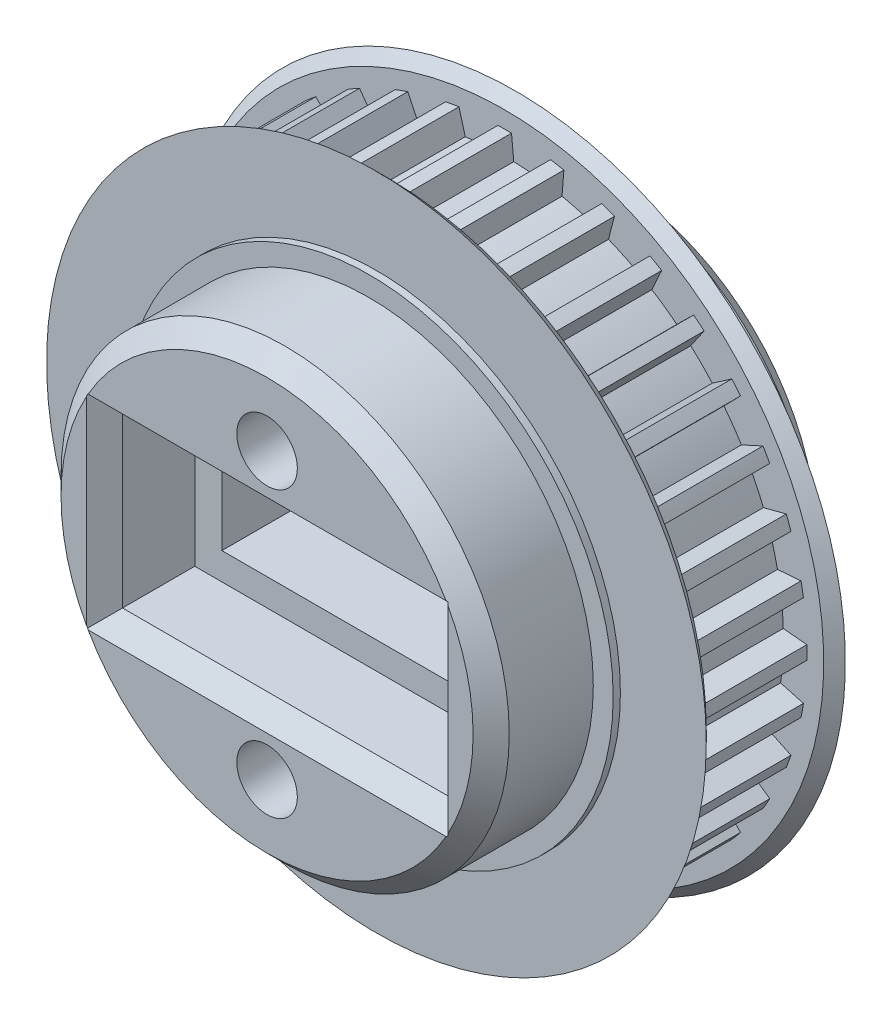
from build123d import *

# Parameters (mm, degrees)
CROQUIS1_R                 = 2
SALIENTE_EXTRUIR1_DEPTH    = 6.5
CROQUIS2_R                 = 18.25
CROQUIS2_R_2               = 2
SALIENTE_EXTRUIR2_DEPTH    = 0.6
SALIENTE_EXTRUIR4_START    = 5.8
CROQUIS4_R                 = 12.45
CROQUIS4_R_2               = 2
SALIENTE_EXTRUIR4_DEPTH    = 5.8
SALIENTE_EXTRUIR6_START    = 0.6
CROQUIS6_R                 = 18.25
CROQUIS6_R_2               = 2
SALIENTE_EXTRUIR6_DEPTH    = 0.6
SALIENTE_EXTRUIR5_START    = 0.4
CROQUIS5_R                 = 13.5
CROQUIS5_R_2               = 2
SALIENTE_EXTRUIR5_DEPTH    = 0.4
CROQUIS3_R                 = 12.4
CROQUIS3_R_2               = 2
SALIENTE_EXTRUIR7_DEPTH    = 6.05
CHAFL_N4_SIZE              = 1
CROQUIS7_R                 = 13.5
CROQUIS7_R_2               = 2
SALIENTE_EXTRUIR8_DEPTH    = 0.4
CORTAR_EXTRUIR1_DEPTH      = 29.966316645
CORTAR_EXTRUIR1_DEPTH_BACK = 29.966316645
CROQUIS8_R                 = 1.675
CROQUIS8_W                 = 15
CROQUIS8_H                 = 6.3
CORTAR_EXTRUIR2_DEPTH      = 7
REDONDEO1_R                = 2.5
CROQUIS10_W                = 18
CROQUIS10_H                = 9.3
CORTAR_EXTRUIR3_DEPTH      = 5
CHAFL_N5_SIZE              = 1
CHAFL_N6_SIZE              = 0.6


# Some blends are built 0.0001 mm under size
with BuildPart() as part:
    # Croquis1 → Saliente-Extruir1 (new body)
    with BuildSketch(Plane.XY):
        with BuildLine():
            Line((-0.375, 16.714216942), (-0.5, 15.410313844))
            ThreePointArc((-0.5, 15.410313844), (-1.343804123, 15.359751406), (-2.18356904, 15.263020639))
            Line((-2.18356904, 15.263020639), (-2.533090406, 16.525408497))
            ThreePointArc((-2.533090406, 16.525408497), (-2.903123715, 16.464432747), (-3.271696221, 16.395172363))
            Line((-3.271696221, 16.395172363), (-3.168376793, 15.089372461))
            ThreePointArc((-3.168376793, 15.089372461), (-3.99058156, 14.893053132), (-4.800791439, 14.651968275))
            Line((-4.800791439, 14.651968275), (-5.364214141, 15.834483876))
            ThreePointArc((-5.364214141, 15.834483876), (-5.718037486, 15.710178876), (-6.068983607, 15.577968769))
            Line((-6.068983607, 15.577968769), (-5.74048406, 14.309948132))
            ThreePointArc((-5.74048406, 14.309948132), (-6.516107195, 13.973836975), (-7.27214422, 13.595723269))
            Line((-7.27214422, 13.595723269), (-8.032348945, 14.662436476))
            ThreePointArc((-8.032348945, 14.662436476), (-8.35921158, 14.478579169), (-8.681867997, 14.287436476))
            Line((-8.681867997, 14.287436476), (-8.138169624, 13.095723269))
            ThreePointArc((-8.138169624, 13.095723269), (-8.843644211, 12.630032852), (-9.522536579, 12.126379092))
            Line((-9.522536579, 12.126379092), (-10.45642489, 13.044878363))
            ThreePointArc((-10.45642489, 13.044878363), (-10.746395261, 12.80705516), (-11.030958222, 12.562787656))
            Line((-11.030958222, 12.562787656), (-10.288581022, 11.483591482))
            ThreePointArc((-10.288581022, 11.483591482), (-10.902471572, 10.902471572), (-11.483591482, 10.288581022))
            Line((-11.483591482, 10.288581022), (-12.562787656, 11.030958222))
            ThreePointArc((-12.562787656, 11.030958222), (-12.80705516, 10.746395261), (-13.044878363, 10.45642489))
            Line((-13.044878363, 10.45642489), (-12.126379092, 9.522536579))
            ThreePointArc((-12.126379092, 9.522536579), (-12.630032852, 8.843644211), (-13.095723269, 8.138169624))
            Line((-13.095723269, 8.138169624), (-14.287436476, 8.681867997))
            ThreePointArc((-14.287436476, 8.681867997), (-14.478579169, 8.35921158), (-14.662436476, 8.032348945))
            Line((-14.662436476, 8.032348945), (-13.595723269, 7.27214422))
            ThreePointArc((-13.595723269, 7.27214422), (-13.973836975, 6.516107195), (-14.309948132, 5.74048406))
            Line((-14.309948132, 5.74048406), (-15.577968769, 6.068983607))
            ThreePointArc((-15.577968769, 6.068983607), (-15.710178876, 5.718037486), (-15.834483876, 5.364214141))
            Line((-15.834483876, 5.364214141), (-14.651968275, 4.800791439))
            ThreePointArc((-14.651968275, 4.800791439), (-14.893053132, 3.99058156), (-15.089372461, 3.168376793))
            Line((-15.089372461, 3.168376793), (-16.395172363, 3.271696221))
            ThreePointArc((-16.395172363, 3.271696221), (-16.464432747, 2.903123715), (-16.525408497, 2.533090406))
            Line((-16.525408497, 2.533090406), (-15.263020639, 2.18356904))
            ThreePointArc((-15.263020639, 2.18356904), (-15.359751406, 1.343804123), (-15.410313844, 0.5))
            Line((-15.410313844, 0.5), (-16.714216942, 0.375))
            ThreePointArc((-16.714216942, 0.375), (-16.718423161, 0), (-16.714216942, -0.375))
            Line((-16.714216942, -0.375), (-15.410313844, -0.5))
            ThreePointArc((-15.410313844, -0.5), (-15.359751406, -1.343804123), (-15.263020639, -2.18356904))
            Line((-15.263020639, -2.18356904), (-16.525408497, -2.533090406))
            ThreePointArc((-16.525408497, -2.533090406), (-16.464432747, -2.903123715), (-16.395172363, -3.271696221))
            Line((-16.395172363, -3.271696221), (-15.089372461, -3.168376793))
            ThreePointArc((-15.089372461, -3.168376793), (-14.893053132, -3.99058156), (-14.651968275, -4.800791439))
            Line((-14.651968275, -4.800791439), (-15.834483876, -5.364214141))
            ThreePointArc((-15.834483876, -5.364214141), (-15.710178876, -5.718037486), (-15.577968769, -6.068983607))
            Line((-15.577968769, -6.068983607), (-14.309948132, -5.74048406))
            ThreePointArc((-14.309948132, -5.74048406), (-13.973836975, -6.516107195), (-13.595723269, -7.27214422))
            Line((-13.595723269, -7.27214422), (-14.662436476, -8.032348945))
            ThreePointArc((-14.662436476, -8.032348945), (-14.478579169, -8.35921158), (-14.287436476, -8.681867997))
            Line((-14.287436476, -8.681867997), (-13.095723269, -8.138169624))
            ThreePointArc((-13.095723269, -8.138169624), (-12.630032852, -8.843644211), (-12.126379092, -9.522536579))
            Line((-12.126379092, -9.522536579), (-13.044878363, -10.45642489))
            ThreePointArc((-13.044878363, -10.45642489), (-12.80705516, -10.746395261), (-12.562787656, -11.030958222))
            Line((-12.562787656, -11.030958222), (-11.483591482, -10.288581022))
            ThreePointArc((-11.483591482, -10.288581022), (-10.902471572, -10.902471572), (-10.288581022, -11.483591482))
            Line((-10.288581022, -11.483591482), (-11.030958222, -12.562787656))
            ThreePointArc((-11.030958222, -12.562787656), (-10.746395261, -12.80705516), (-10.45642489, -13.044878363))
            Line((-10.45642489, -13.044878363), (-9.522536579, -12.126379092))
            ThreePointArc((-9.522536579, -12.126379092), (-8.843644211, -12.630032852), (-8.138169624, -13.095723269))
            Line((-8.138169624, -13.095723269), (-8.681867997, -14.287436476))
            ThreePointArc((-8.681867997, -14.287436476), (-8.35921158, -14.478579169), (-8.032348945, -14.662436476))
            Line((-8.032348945, -14.662436476), (-7.27214422, -13.595723269))
            ThreePointArc((-7.27214422, -13.595723269), (-6.516107195, -13.973836975), (-5.74048406, -14.309948132))
            Line((-5.74048406, -14.309948132), (-6.068983607, -15.577968769))
            ThreePointArc((-6.068983607, -15.577968769), (-5.718037486, -15.710178876), (-5.364214141, -15.834483876))
            Line((-5.364214141, -15.834483876), (-4.800791439, -14.651968275))
            ThreePointArc((-4.800791439, -14.651968275), (-3.99058156, -14.893053132), (-3.168376793, -15.089372461))
            Line((-3.168376793, -15.089372461), (-3.271696221, -16.395172363))
            ThreePointArc((-3.271696221, -16.395172363), (-2.903123715, -16.464432747), (-2.533090406, -16.525408497))
            Line((-2.533090406, -16.525408497), (-2.18356904, -15.263020639))
            ThreePointArc((-2.18356904, -15.263020639), (-1.343804123, -15.359751406), (-0.5, -15.410313844))
            Line((-0.5, -15.410313844), (-0.375, -16.714216942))
            ThreePointArc((-0.375, -16.714216942), (0, -16.718423161), (0.375, -16.714216942))
            Line((0.375, -16.714216942), (0.5, -15.410313844))
            ThreePointArc((0.5, -15.410313844), (1.343804123, -15.359751406), (2.18356904, -15.263020639))
            Line((2.18356904, -15.263020639), (2.533090406, -16.525408497))
            ThreePointArc((2.533090406, -16.525408497), (2.903123715, -16.464432747), (3.271696221, -16.395172363))
            Line((3.271696221, -16.395172363), (3.168376793, -15.089372461))
            ThreePointArc((3.168376793, -15.089372461), (3.99058156, -14.893053132), (4.800791439, -14.651968275))
            Line((4.800791439, -14.651968275), (5.364214141, -15.834483876))
            ThreePointArc((5.364214141, -15.834483876), (5.718037486, -15.710178876), (6.068983607, -15.577968769))
            Line((6.068983607, -15.577968769), (5.74048406, -14.309948132))
            ThreePointArc((5.74048406, -14.309948132), (6.516107195, -13.973836975), (7.27214422, -13.595723269))
            Line((7.27214422, -13.595723269), (8.032348945, -14.662436476))
            ThreePointArc((8.032348945, -14.662436476), (8.35921158, -14.478579169), (8.681867997, -14.287436476))
            Line((8.681867997, -14.287436476), (8.138169624, -13.095723269))
            ThreePointArc((8.138169624, -13.095723269), (8.843644211, -12.630032852), (9.522536579, -12.126379092))
            Line((9.522536579, -12.126379092), (10.45642489, -13.044878363))
            ThreePointArc((10.45642489, -13.044878363), (10.746395261, -12.80705516), (11.030958222, -12.562787656))
            Line((11.030958222, -12.562787656), (10.288581022, -11.483591482))
            ThreePointArc((10.288581022, -11.483591482), (10.902471572, -10.902471572), (11.483591482, -10.288581022))
            Line((11.483591482, -10.288581022), (12.562787656, -11.030958222))
            ThreePointArc((12.562787656, -11.030958222), (12.80705516, -10.746395261), (13.044878363, -10.45642489))
            Line((13.044878363, -10.45642489), (12.126379092, -9.522536579))
            ThreePointArc((12.126379092, -9.522536579), (12.630032852, -8.843644211), (13.095723269, -8.138169624))
            Line((13.095723269, -8.138169624), (14.287436476, -8.681867997))
            ThreePointArc((14.287436476, -8.681867997), (14.478579169, -8.35921158), (14.662436476, -8.032348945))
            Line((14.662436476, -8.032348945), (13.595723269, -7.27214422))
            ThreePointArc((13.595723269, -7.27214422), (13.973836975, -6.516107195), (14.309948132, -5.74048406))
            Line((14.309948132, -5.74048406), (15.577968769, -6.068983607))
            ThreePointArc((15.577968769, -6.068983607), (15.710178876, -5.718037486), (15.834483876, -5.364214141))
            Line((15.834483876, -5.364214141), (14.651968275, -4.800791439))
            ThreePointArc((14.651968275, -4.800791439), (14.893053132, -3.99058156), (15.089372461, -3.168376793))
            Line((15.089372461, -3.168376793), (16.395172363, -3.271696221))
            ThreePointArc((16.395172363, -3.271696221), (16.464432747, -2.903123715), (16.525408497, -2.533090406))
            Line((16.525408497, -2.533090406), (15.263020639, -2.18356904))
            ThreePointArc((15.263020639, -2.18356904), (15.359751406, -1.343804123), (15.410313844, -0.5))
            Line((15.410313844, -0.5), (16.714216942, -0.375))
            ThreePointArc((16.714216942, -0.375), (16.718423161, 0), (16.714216942, 0.375))
            Line((16.714216942, 0.375), (15.410313844, 0.5))
            ThreePointArc((15.410313844, 0.5), (15.359751406, 1.343804123), (15.263020639, 2.18356904))
            Line((15.263020639, 2.18356904), (16.525408497, 2.533090406))
            ThreePointArc((16.525408497, 2.533090406), (16.464432747, 2.903123715), (16.395172363, 3.271696221))
            Line((16.395172363, 3.271696221), (15.089372461, 3.168376793))
            ThreePointArc((15.089372461, 3.168376793), (14.893053132, 3.99058156), (14.651968275, 4.800791439))
            Line((14.651968275, 4.800791439), (15.834483876, 5.364214141))
            ThreePointArc((15.834483876, 5.364214141), (15.710178876, 5.718037486), (15.577968769, 6.068983607))
            Line((15.577968769, 6.068983607), (14.309948132, 5.74048406))
            ThreePointArc((14.309948132, 5.74048406), (13.973836975, 6.516107195), (13.595723269, 7.27214422))
            Line((13.595723269, 7.27214422), (14.662436476, 8.032348945))
            ThreePointArc((14.662436476, 8.032348945), (14.478579169, 8.35921158), (14.287436476, 8.681867997))
            Line((14.287436476, 8.681867997), (13.095723269, 8.138169624))
            ThreePointArc((13.095723269, 8.138169624), (12.630032852, 8.843644211), (12.126379092, 9.522536579))
            Line((12.126379092, 9.522536579), (13.044878363, 10.45642489))
            ThreePointArc((13.044878363, 10.45642489), (12.80705516, 10.746395261), (12.562787656, 11.030958222))
            Line((12.562787656, 11.030958222), (11.483591482, 10.288581022))
            ThreePointArc((11.483591482, 10.288581022), (10.902471572, 10.902471572), (10.288581022, 11.483591482))
            Line((10.288581022, 11.483591482), (11.030958222, 12.562787656))
            ThreePointArc((11.030958222, 12.562787656), (10.746395261, 12.80705516), (10.45642489, 13.044878363))
            Line((10.45642489, 13.044878363), (9.522536579, 12.126379092))
            ThreePointArc((9.522536579, 12.126379092), (8.843644211, 12.630032852), (8.138169624, 13.095723269))
            Line((8.138169624, 13.095723269), (8.681867997, 14.287436476))
            ThreePointArc((8.681867997, 14.287436476), (8.35921158, 14.478579169), (8.032348945, 14.662436476))
            Line((8.032348945, 14.662436476), (7.27214422, 13.595723269))
            ThreePointArc((7.27214422, 13.595723269), (6.516107195, 13.973836975), (5.74048406, 14.309948132))
            Line((5.74048406, 14.309948132), (6.068983607, 15.577968769))
            ThreePointArc((6.068983607, 15.577968769), (5.718037486, 15.710178876), (5.364214141, 15.834483876))
            Line((5.364214141, 15.834483876), (4.800791439, 14.651968275))
            ThreePointArc((4.800791439, 14.651968275), (3.99058156, 14.893053132), (3.168376793, 15.089372461))
            Line((3.168376793, 15.089372461), (3.271696221, 16.395172363))
            ThreePointArc((3.271696221, 16.395172363), (2.903123715, 16.464432747), (2.533090406, 16.525408497))
            Line((2.533090406, 16.525408497), (2.18356904, 15.263020639))
            ThreePointArc((2.18356904, 15.263020639), (1.343804123, 15.359751406), (0.5, 15.410313844))
            Line((0.5, 15.410313844), (0.375, 16.714216942))
            ThreePointArc((0.375, 16.714216942), (0, 16.718423161), (-0.375, 16.714216942))
        make_face()
        with Locations(Location((0, 0, 0), (0, 0, 180))):
            Circle(CROQUIS1_R, mode=Mode.SUBTRACT)
    extrude(amount=SALIENTE_EXTRUIR1_DEPTH)

    # Croquis2 → Saliente-Extruir2 (add)
    with BuildSketch(Plane.XY.offset(6.5)):
        Circle(CROQUIS2_R)
        with Locations(Location((0, 0, 0), (0, 0, 180))):
            Circle(CROQUIS2_R_2, mode=Mode.SUBTRACT)
    extrude(amount=SALIENTE_EXTRUIR2_DEPTH)

    # Croquis4 → Saliente-Extruir4 (add)
    with BuildSketch(Plane(origin=(0, 0, 0), x_dir=(-1, 0, 0), z_dir=(0, 0, -1)).offset(SALIENTE_EXTRUIR4_START)):
        with Locations(Location((0, 0, 0), (0, 0, 180))):
            Circle(CROQUIS4_R)
        Circle(CROQUIS4_R_2, mode=Mode.SUBTRACT)
    extrude(amount=-SALIENTE_EXTRUIR4_DEPTH)

    # Croquis6 → Saliente-Extruir6 (add)
    with BuildSketch(Plane(origin=(0, 0, 0), x_dir=(-1, 0, 0), z_dir=(0, 0, -1)).offset(SALIENTE_EXTRUIR6_START)):
        with Locations(Location((0, 0, 0), (0, 0, 180))):
            Circle(CROQUIS6_R)
        Circle(CROQUIS6_R_2, mode=Mode.SUBTRACT)
    extrude(amount=-SALIENTE_EXTRUIR6_DEPTH)

    # Croquis5 → Saliente-Extruir5 (add)
    with BuildSketch(Plane(origin=(0, 0, -0.6), x_dir=(-1, 0, 0), z_dir=(0, 0, -1)).offset(SALIENTE_EXTRUIR5_START)):
        Circle(CROQUIS5_R)
        Circle(CROQUIS5_R_2, mode=Mode.SUBTRACT)
    extrude(amount=-SALIENTE_EXTRUIR5_DEPTH)

    # Croquis3 → Saliente-Extruir7 (add)
    with BuildSketch(Plane.XY.offset(7.1)):
        Circle(CROQUIS3_R)
        with Locations(Location((0, 0, 0), (0, 0, 180))):
            Circle(CROQUIS3_R_2, mode=Mode.SUBTRACT)
    extrude(amount=SALIENTE_EXTRUIR7_DEPTH)

    # Chaflán4
    chafl_n4_edges = [part.edges().sort_by_distance(p)[0] for p in [
        (-12.45, 0, -5.8),
        (-12.4, 0, 13.15),
    ]]
    chamfer(chafl_n4_edges, length=CHAFL_N4_SIZE)

    # Croquis7 → Saliente-Extruir8 (add)
    with BuildSketch(Plane.XY.offset(7.1)):
        with Locations(Location((0, 0, 0), (0, 0, 180))):
            Circle(CROQUIS7_R)
        with Locations(Location((0, 0, 0), (0, 0, 180))):
            Circle(CROQUIS7_R_2, mode=Mode.SUBTRACT)
    extrude(amount=SALIENTE_EXTRUIR8_DEPTH)

    # Croquis8 → Cortar-Extruir1 (cut, two sides: drawn at the far end of the back side and taken through both)
    with BuildSketch(Plane.XY.offset(-CORTAR_EXTRUIR1_DEPTH_BACK)):
        with Locations((0, 7.875631857)):
            Circle(CROQUIS8_R)
        with Locations((0, -7.875631857)):
            Circle(CROQUIS8_R)
        Rectangle(CROQUIS8_W, CROQUIS8_H)
    extrude(amount=CORTAR_EXTRUIR1_DEPTH + CORTAR_EXTRUIR1_DEPTH_BACK, mode=Mode.SUBTRACT)

    # Croquis9 → Cortar-Extruir2 (cut)
    with BuildSketch(Plane(origin=(0, 0, -5.8), x_dir=(-1, 0, 0), z_dir=(0, 0, -1))):
        Polygon((2.33826859, 3.825631857), (4.67653718, 7.875631857), (2.33826859, 11.925631857), (-2.33826859, 11.925631857), (-4.67653718, 7.875631857), (-2.33826859, 3.825631857), align=None)
        Polygon((2.33826859, -11.925631857), (4.67653718, -7.875631857), (2.33826859, -3.825631857), (-2.33826859, -3.825631857), (-4.67653718, -7.875631857), (-2.33826859, -11.925631857), align=None)
    extrude(amount=-CORTAR_EXTRUIR2_DEPTH, mode=Mode.SUBTRACT)

    # Redondeo1
    redondeo1_edges = [part.edges().sort_by_distance(p)[0] for p in [
        (0, 3.825631857, 1.2),
        (3.507402885, 5.850631857, 1.2),
        (3.507402885, 9.900631857, 1.2),
        (0, 11.925631857, 1.2),
        (-3.507402885, 9.900631857, 1.2),
        (-3.507402885, 5.850631857, 1.2),
        (0, -11.925631857, 1.2),
        (3.507402885, -9.900631857, 1.2),
        (3.507402885, -5.850631857, 1.2),
        (0, -3.825631857, 1.2),
        (-3.507402885, -5.850631857, 1.2),
        (-3.507402885, -9.900631857, 1.2),
    ]]
    fillet(redondeo1_edges, radius=REDONDEO1_R)

    # Croquis10 → Cortar-Extruir3 (cut)
    with BuildSketch(Plane.XY.offset(13.15)):
        Rectangle(CROQUIS10_W, CROQUIS10_H)
    extrude(amount=-CORTAR_EXTRUIR3_DEPTH, mode=Mode.SUBTRACT)

    # Chaflán5
    # the kernel refuses this chamfer: 1 mm, written as the material it takes off along each edge
    with BuildSketch(Plane(origin=(-7.5, -3.15, -5.8), x_dir=(-0.9996219169112968, 0, -0.02749587661058651), z_dir=(0, 1, 0)), Plane(origin=(7.5, 3.15, -5.8), x_dir=(0.9996219169112968, 0, -0.02749587661058651), z_dir=(0, -1, 0))) as chafl_n5_piece_1:
        Polygon((CHAFL_N5_SIZE * 0.999621916911, CHAFL_N5_SIZE * 0.0274958766106), (-CHAFL_N5_SIZE * 0.0274958766106, CHAFL_N5_SIZE * 0.999621916911), (0, 0), align=None)
    extrude(amount=6.3, mode=Mode.SUBTRACT)
    with BuildSketch(Plane(origin=(-7.5, 3.15, -5.8), x_dir=(0, 0.9996219169112968, -0.027495876610586487), z_dir=(1, 0, 0)), Plane(origin=(7.5, -3.15, -5.8), x_dir=(0, -0.9996219169112968, -0.027495876610586487), z_dir=(-1, 0, 0))) as chafl_n5_piece_2:
        Polygon((CHAFL_N5_SIZE * 0.999621916911, CHAFL_N5_SIZE * 0.0274958766106), (-CHAFL_N5_SIZE * 0.0274958766106, CHAFL_N5_SIZE * 0.999621916911), (0, 0), align=None)
    extrude(amount=15, mode=Mode.SUBTRACT)
    with BuildSketch(Plane(origin=(9, -4.65, 13.15), x_dir=(0.9996219169112968, 0, 0.027495876610585647), z_dir=(0, 1, 0)), Plane(origin=(-9, 4.65, 13.15), x_dir=(-0.9996219169112968, 0, 0.027495876610585647), z_dir=(0, -1, 0))) as chafl_n5_piece_3:
        Polygon((CHAFL_N5_SIZE * 0.999621916911, CHAFL_N5_SIZE * 0.0274958766106), (-CHAFL_N5_SIZE * 0.0274958766106, CHAFL_N5_SIZE * 0.999621916911), (0, 0), align=None)
    extrude(amount=9.3, mode=Mode.SUBTRACT)
    with BuildSketch(Plane(origin=(9, 4.65, 13.15), x_dir=(0, 0.9996219169112968, 0.027495876610585623), z_dir=(-1, 0, 0)), Plane(origin=(-9, -4.65, 13.15), x_dir=(0, -0.9996219169112968, 0.027495876610585623), z_dir=(1, 0, 0))) as chafl_n5_piece_4:
        Polygon((CHAFL_N5_SIZE * 0.999621916911, CHAFL_N5_SIZE * 0.0274958766106), (-CHAFL_N5_SIZE * 0.0274958766106, CHAFL_N5_SIZE * 0.999621916911), (0, 0), align=None)
    extrude(amount=18, mode=Mode.SUBTRACT)
    with BuildSketch(Plane(origin=(-7.5, -5.721682988, -5.8), x_dir=(-0.9996219169112968, 0, -0.02749587661058651), z_dir=(0, 1, 0))) as chafl_n5_piece_5a_section:
        Polygon((CHAFL_N5_SIZE * 0.999621916911, CHAFL_N5_SIZE * 0.0274958766106), (-CHAFL_N5_SIZE * 0.0274958766106, CHAFL_N5_SIZE * 0.999621916911), (0, 0), align=None)
    chafl_n5_piece_5a = extrude(amount=8.871682988, mode=Mode.PRIVATE)
    chafl_n5_piece_5a = split(chafl_n5_piece_5a, bisect_by=Plane(origin=(-7.829793627, -3.15, -5.470206373), z_dir=(0, -1, 0)), keep=Keep.TOP, mode=Mode.PRIVATE)
    with BuildSketch(Plane(origin=(7.5, -3.15, -5.8), x_dir=(0, -0.9996219169112968, -0.027495876610586487), z_dir=(-1, 0, 0))) as chafl_n5_piece_5b_section:
        Polygon((CHAFL_N5_SIZE * 0.999621916911, CHAFL_N5_SIZE * 0.0274958766106), (-CHAFL_N5_SIZE * 0.0274958766106, CHAFL_N5_SIZE * 0.999621916911), (0, 0), align=None)
    chafl_n5_piece_5b = extrude(amount=17.571682988, mode=Mode.PRIVATE)
    chafl_n5_piece_5b = split(chafl_n5_piece_5b, bisect_by=Plane(origin=(-7.5, -3.479793627, -5.470206373), z_dir=(-1, 0, 0)), keep=Keep.TOP, mode=Mode.PRIVATE)
    chafl_n5_piece_5 = chafl_n5_piece_5a & chafl_n5_piece_5b
    add(chafl_n5_piece_5, mode=Mode.SUBTRACT)
    with BuildSketch(Plane(origin=(-10.071682988, 3.15, -5.8), x_dir=(0, 0.9996219169112968, -0.027495876610586487), z_dir=(1, 0, 0))) as chafl_n5_piece_6a_section:
        Polygon((CHAFL_N5_SIZE * 0.999621916911, CHAFL_N5_SIZE * 0.0274958766106), (-CHAFL_N5_SIZE * 0.0274958766106, CHAFL_N5_SIZE * 0.999621916911), (0, 0), align=None)
    chafl_n5_piece_6a = extrude(amount=17.571682988, mode=Mode.PRIVATE)
    chafl_n5_piece_6a = split(chafl_n5_piece_6a, bisect_by=Plane(origin=(-7.5, 3.479793627, -5.470206373), z_dir=(-1, 0, 0)), keep=Keep.TOP, mode=Mode.PRIVATE)
    with BuildSketch(Plane(origin=(-7.5, -3.15, -5.8), x_dir=(-0.9996219169112968, 0, -0.02749587661058651), z_dir=(0, 1, 0))) as chafl_n5_piece_6b_section:
        Polygon((CHAFL_N5_SIZE * 0.999621916911, CHAFL_N5_SIZE * 0.0274958766106), (-CHAFL_N5_SIZE * 0.0274958766106, CHAFL_N5_SIZE * 0.999621916911), (0, 0), align=None)
    chafl_n5_piece_6b = extrude(amount=8.871682988, mode=Mode.PRIVATE)
    chafl_n5_piece_6b = split(chafl_n5_piece_6b, bisect_by=Plane(origin=(-7.829793627, 3.15, -5.470206373), z_dir=(0, 1, 0)), keep=Keep.TOP, mode=Mode.PRIVATE)
    chafl_n5_piece_6 = chafl_n5_piece_6a & chafl_n5_piece_6b
    add(chafl_n5_piece_6, mode=Mode.SUBTRACT)
    with BuildSketch(Plane(origin=(-7.5, 3.15, -5.8), x_dir=(0, 0.9996219169112968, -0.027495876610586487), z_dir=(1, 0, 0))) as chafl_n5_piece_7a_section:
        Polygon((CHAFL_N5_SIZE * 0.999621916911, CHAFL_N5_SIZE * 0.0274958766106), (-CHAFL_N5_SIZE * 0.0274958766106, CHAFL_N5_SIZE * 0.999621916911), (0, 0), align=None)
    chafl_n5_piece_7a = extrude(amount=17.571682988, mode=Mode.PRIVATE)
    chafl_n5_piece_7a = split(chafl_n5_piece_7a, bisect_by=Plane(origin=(7.5, 3.479793627, -5.470206373), z_dir=(1, 0, 0)), keep=Keep.TOP, mode=Mode.PRIVATE)
    with BuildSketch(Plane(origin=(7.5, 5.721682988, -5.8), x_dir=(0.9996219169112968, 0, -0.02749587661058651), z_dir=(0, -1, 0))) as chafl_n5_piece_7b_section:
        Polygon((CHAFL_N5_SIZE * 0.999621916911, CHAFL_N5_SIZE * 0.0274958766106), (-CHAFL_N5_SIZE * 0.0274958766106, CHAFL_N5_SIZE * 0.999621916911), (0, 0), align=None)
    chafl_n5_piece_7b = extrude(amount=8.871682988, mode=Mode.PRIVATE)
    chafl_n5_piece_7b = split(chafl_n5_piece_7b, bisect_by=Plane(origin=(7.829793627, 3.15, -5.470206373), z_dir=(0, 1, 0)), keep=Keep.TOP, mode=Mode.PRIVATE)
    chafl_n5_piece_7 = chafl_n5_piece_7a & chafl_n5_piece_7b
    add(chafl_n5_piece_7, mode=Mode.SUBTRACT)
    with BuildSketch(Plane(origin=(7.5, 3.15, -5.8), x_dir=(0.9996219169112968, 0, -0.02749587661058651), z_dir=(0, -1, 0))) as chafl_n5_piece_8a_section:
        Polygon((CHAFL_N5_SIZE * 0.999621916911, CHAFL_N5_SIZE * 0.0274958766106), (-CHAFL_N5_SIZE * 0.0274958766106, CHAFL_N5_SIZE * 0.999621916911), (0, 0), align=None)
    chafl_n5_piece_8a = extrude(amount=8.871682988, mode=Mode.PRIVATE)
    chafl_n5_piece_8a = split(chafl_n5_piece_8a, bisect_by=Plane(origin=(7.829793627, -3.15, -5.470206373), z_dir=(0, -1, 0)), keep=Keep.TOP, mode=Mode.PRIVATE)
    with BuildSketch(Plane(origin=(10.071682988, -3.15, -5.8), x_dir=(0, -0.9996219169112968, -0.027495876610586487), z_dir=(-1, 0, 0))) as chafl_n5_piece_8b_section:
        Polygon((CHAFL_N5_SIZE * 0.999621916911, CHAFL_N5_SIZE * 0.0274958766106), (-CHAFL_N5_SIZE * 0.0274958766106, CHAFL_N5_SIZE * 0.999621916911), (0, 0), align=None)
    chafl_n5_piece_8b = extrude(amount=17.571682988, mode=Mode.PRIVATE)
    chafl_n5_piece_8b = split(chafl_n5_piece_8b, bisect_by=Plane(origin=(7.5, -3.479793627, -5.470206373), z_dir=(1, 0, 0)), keep=Keep.TOP, mode=Mode.PRIVATE)
    chafl_n5_piece_8 = chafl_n5_piece_8a & chafl_n5_piece_8b
    add(chafl_n5_piece_8, mode=Mode.SUBTRACT)
    with BuildSketch(Plane(origin=(-9, -4.65, 13.15), x_dir=(0, -0.9996219169112968, 0.027495876610585623), z_dir=(1, 0, 0))) as chafl_n5_piece_9a_section:
        Polygon((CHAFL_N5_SIZE * 0.999621916911, CHAFL_N5_SIZE * 0.0274958766106), (-CHAFL_N5_SIZE * 0.0274958766106, CHAFL_N5_SIZE * 0.999621916911), (0, 0), align=None)
    chafl_n5_piece_9a = extrude(amount=20.571682988, mode=Mode.PRIVATE)
    chafl_n5_piece_9a = split(chafl_n5_piece_9a, bisect_by=Plane(origin=(9, -4.979793627, 12.820206373), z_dir=(1, 0, 0)), keep=Keep.TOP, mode=Mode.PRIVATE)
    with BuildSketch(Plane(origin=(9, -7.221682988, 13.15), x_dir=(0.9996219169112968, 0, 0.027495876610585647), z_dir=(0, 1, 0))) as chafl_n5_piece_9b_section:
        Polygon((CHAFL_N5_SIZE * 0.999621916911, CHAFL_N5_SIZE * 0.0274958766106), (-CHAFL_N5_SIZE * 0.0274958766106, CHAFL_N5_SIZE * 0.999621916911), (0, 0), align=None)
    chafl_n5_piece_9b = extrude(amount=11.871682988, mode=Mode.PRIVATE)
    chafl_n5_piece_9b = split(chafl_n5_piece_9b, bisect_by=Plane(origin=(9.329793627, -4.65, 12.820206373), z_dir=(0, -1, 0)), keep=Keep.TOP, mode=Mode.PRIVATE)
    chafl_n5_piece_9 = chafl_n5_piece_9a & chafl_n5_piece_9b
    add(chafl_n5_piece_9, mode=Mode.SUBTRACT)
    with BuildSketch(Plane(origin=(11.571682988, 4.65, 13.15), x_dir=(0, 0.9996219169112968, 0.027495876610585623), z_dir=(-1, 0, 0))) as chafl_n5_piece_10a_section:
        Polygon((CHAFL_N5_SIZE * 0.999621916911, CHAFL_N5_SIZE * 0.0274958766106), (-CHAFL_N5_SIZE * 0.0274958766106, CHAFL_N5_SIZE * 0.999621916911), (0, 0), align=None)
    chafl_n5_piece_10a = extrude(amount=20.571682988, mode=Mode.PRIVATE)
    chafl_n5_piece_10a = split(chafl_n5_piece_10a, bisect_by=Plane(origin=(9, 4.979793627, 12.820206373), z_dir=(1, 0, 0)), keep=Keep.TOP, mode=Mode.PRIVATE)
    with BuildSketch(Plane(origin=(9, -4.65, 13.15), x_dir=(0.9996219169112968, 0, 0.027495876610585647), z_dir=(0, 1, 0))) as chafl_n5_piece_10b_section:
        Polygon((CHAFL_N5_SIZE * 0.999621916911, CHAFL_N5_SIZE * 0.0274958766106), (-CHAFL_N5_SIZE * 0.0274958766106, CHAFL_N5_SIZE * 0.999621916911), (0, 0), align=None)
    chafl_n5_piece_10b = extrude(amount=11.871682988, mode=Mode.PRIVATE)
    chafl_n5_piece_10b = split(chafl_n5_piece_10b, bisect_by=Plane(origin=(9.329793627, 4.65, 12.820206373), z_dir=(0, 1, 0)), keep=Keep.TOP, mode=Mode.PRIVATE)
    chafl_n5_piece_10 = chafl_n5_piece_10a & chafl_n5_piece_10b
    add(chafl_n5_piece_10, mode=Mode.SUBTRACT)
    with BuildSketch(Plane(origin=(9, 4.65, 13.15), x_dir=(0, 0.9996219169112968, 0.027495876610585623), z_dir=(-1, 0, 0))) as chafl_n5_piece_11a_section:
        Polygon((CHAFL_N5_SIZE * 0.999621916911, CHAFL_N5_SIZE * 0.0274958766106), (-CHAFL_N5_SIZE * 0.0274958766106, CHAFL_N5_SIZE * 0.999621916911), (0, 0), align=None)
    chafl_n5_piece_11a = extrude(amount=20.571682988, mode=Mode.PRIVATE)
    chafl_n5_piece_11a = split(chafl_n5_piece_11a, bisect_by=Plane(origin=(-9, 4.979793627, 12.820206373), z_dir=(-1, 0, 0)), keep=Keep.TOP, mode=Mode.PRIVATE)
    with BuildSketch(Plane(origin=(-9, 7.221682988, 13.15), x_dir=(-0.9996219169112968, 0, 0.027495876610585647), z_dir=(0, -1, 0))) as chafl_n5_piece_11b_section:
        Polygon((CHAFL_N5_SIZE * 0.999621916911, CHAFL_N5_SIZE * 0.0274958766106), (-CHAFL_N5_SIZE * 0.0274958766106, CHAFL_N5_SIZE * 0.999621916911), (0, 0), align=None)
    chafl_n5_piece_11b = extrude(amount=11.871682988, mode=Mode.PRIVATE)
    chafl_n5_piece_11b = split(chafl_n5_piece_11b, bisect_by=Plane(origin=(-9.329793627, 4.65, 12.820206373), z_dir=(0, 1, 0)), keep=Keep.TOP, mode=Mode.PRIVATE)
    chafl_n5_piece_11 = chafl_n5_piece_11a & chafl_n5_piece_11b
    add(chafl_n5_piece_11, mode=Mode.SUBTRACT)
    with BuildSketch(Plane(origin=(-9, 4.65, 13.15), x_dir=(-0.9996219169112968, 0, 0.027495876610585647), z_dir=(0, -1, 0))) as chafl_n5_piece_12a_section:
        Polygon((CHAFL_N5_SIZE * 0.999621916911, CHAFL_N5_SIZE * 0.0274958766106), (-CHAFL_N5_SIZE * 0.0274958766106, CHAFL_N5_SIZE * 0.999621916911), (0, 0), align=None)
    chafl_n5_piece_12a = extrude(amount=11.871682988, mode=Mode.PRIVATE)
    chafl_n5_piece_12a = split(chafl_n5_piece_12a, bisect_by=Plane(origin=(-9.329793627, -4.65, 12.820206373), z_dir=(0, -1, 0)), keep=Keep.TOP, mode=Mode.PRIVATE)
    with BuildSketch(Plane(origin=(-11.571682988, -4.65, 13.15), x_dir=(0, -0.9996219169112968, 0.027495876610585623), z_dir=(1, 0, 0))) as chafl_n5_piece_12b_section:
        Polygon((CHAFL_N5_SIZE * 0.999621916911, CHAFL_N5_SIZE * 0.0274958766106), (-CHAFL_N5_SIZE * 0.0274958766106, CHAFL_N5_SIZE * 0.999621916911), (0, 0), align=None)
    chafl_n5_piece_12b = extrude(amount=20.571682988, mode=Mode.PRIVATE)
    chafl_n5_piece_12b = split(chafl_n5_piece_12b, bisect_by=Plane(origin=(-9, -4.979793627, 12.820206373), z_dir=(-1, 0, 0)), keep=Keep.TOP, mode=Mode.PRIVATE)
    chafl_n5_piece_12 = chafl_n5_piece_12a & chafl_n5_piece_12b
    add(chafl_n5_piece_12, mode=Mode.SUBTRACT)

    # Chaflán6
    chafl_n6_edges = [part.edges().sort_by_distance(p)[0] for p in [
        (-18.25, 0, 6.5),
        (-18.25, 0, 0),
    ]]
    chamfer(chafl_n6_edges, length=CHAFL_N6_SIZE - 0.0001)  # a hair under: the kernel refuses the full size


solid = part.part
